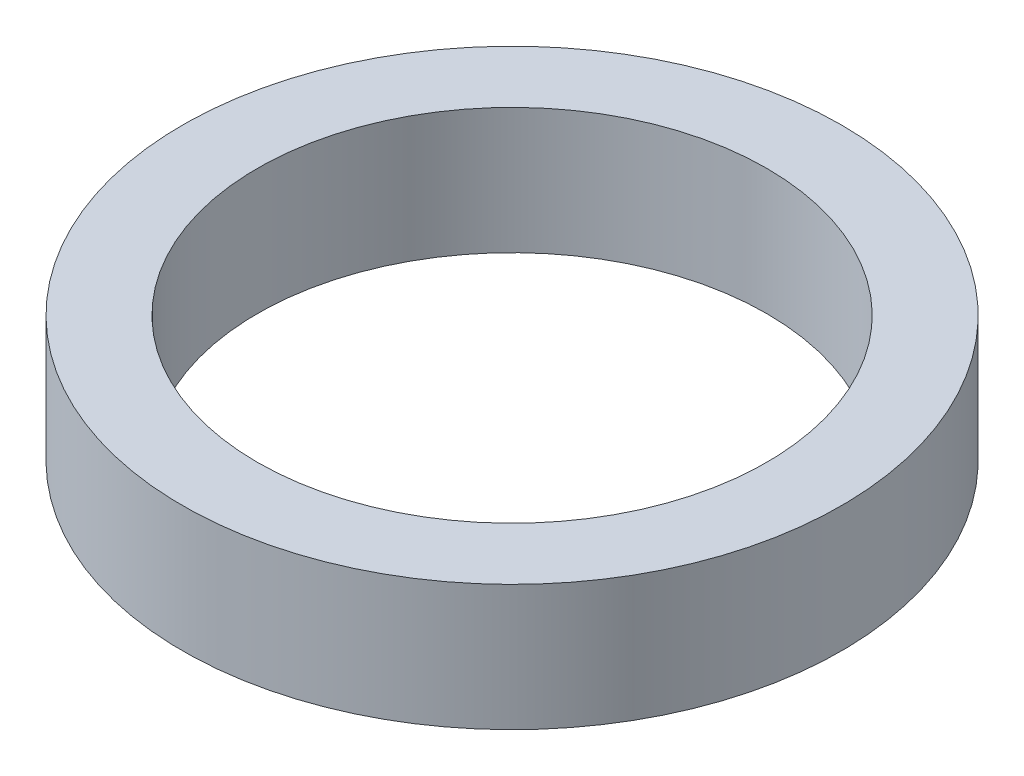
from build123d import *

# Parameters (mm, degrees)
SKETCH1_R           = 55
BOSS_EXTRUDE1_DEPTH = 21
SKETCH2_R           = 42.5
CUT_EXTRUDE1_DEPTH  = 81.566742518


with BuildPart() as part:
    # Sketch1 → Boss-Extrude1 (new body)
    with BuildSketch(Plane(origin=(0, 0, 0), x_dir=(1, 0, 0), z_dir=(0, 1, 0))):
        Circle(SKETCH1_R)
    extrude(amount=BOSS_EXTRUDE1_DEPTH)

    # Sketch2 → Cut-Extrude1 (cut, through all)
    with BuildSketch(Plane(origin=(0, 0, 0), x_dir=(1, 0, 0), z_dir=(0, 1, 0))):
        Circle(SKETCH2_R)
    extrude(amount=CUT_EXTRUDE1_DEPTH, mode=Mode.SUBTRACT)


solid = part.part
